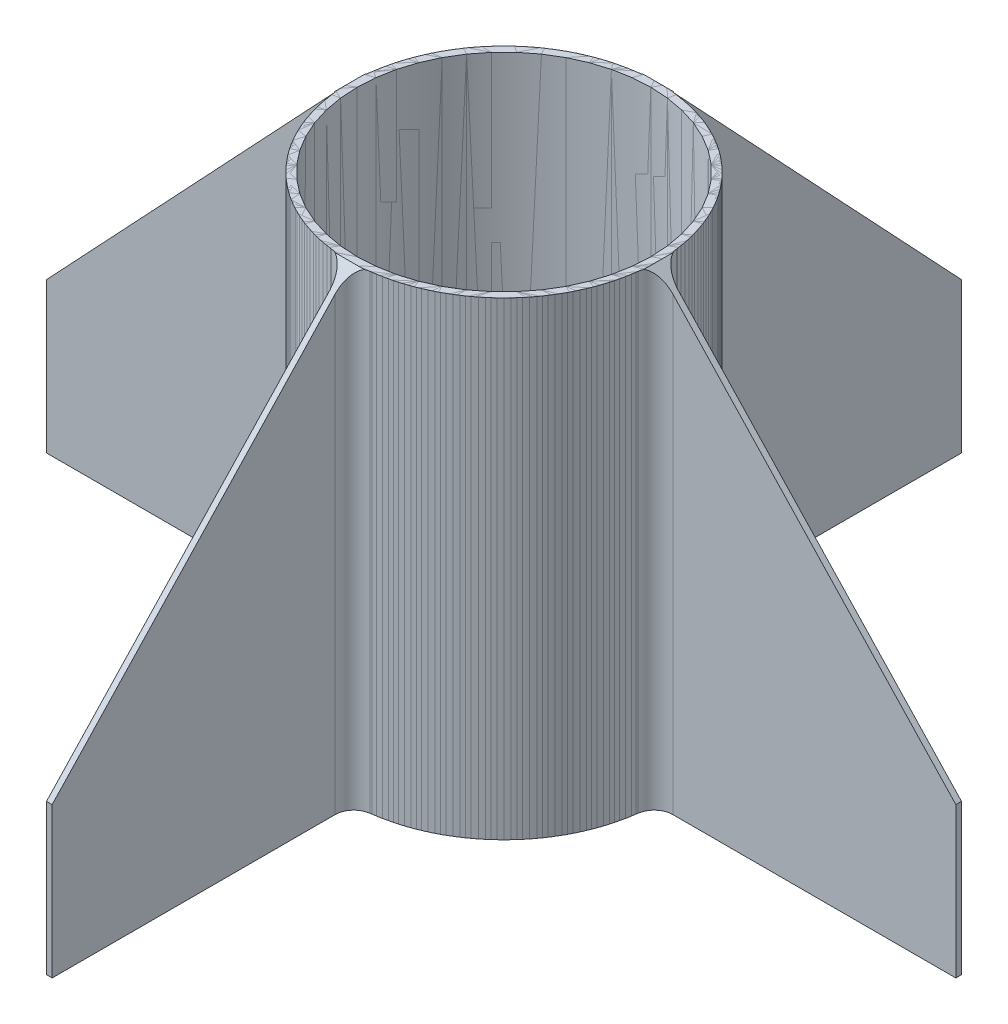
from build123d import *

# Parameters (mm, degrees)
SKETCH1_R                = 82.2
SKETCH1_R_2              = 78.2
BOSS_EXTRUDE1_DEPTH      = 250
BOSS_EXTRUDE2_DEPTH      = 1.5
BOSS_EXTRUDE2_DEPTH_BACK = 1.5
BOSS_EXTRUDE3_DEPTH      = 1.5
BOSS_EXTRUDE3_DEPTH_BACK = 1.5
SKETCH4_W                = 2
SKETCH4_H                = 250
FILLET1_R                = 10
CIRPATTERN1_COUNT        = 4


with BuildPart() as part:
    # Sketch1 → Boss-Extrude1 (new body)
    with BuildSketch(Plane(origin=(0, 0, 0), x_dir=(1, 0, 0), z_dir=(0, 1, 0))):
        with Locations(Location((0, 0, 0), (0, 0, 270))):
            Circle(SKETCH1_R)
        with Locations(Location((0, 0, 0), (0, 0, 270))):
            Circle(SKETCH1_R_2, mode=Mode.SUBTRACT)
    extrude(amount=BOSS_EXTRUDE1_DEPTH)



with BuildPart() as body_2:
    # Sketch2 → Boss-Extrude2 (new, two sides: drawn at the far end of the back side and taken through both)
    with BuildSketch(Plane.XY.offset(-BOSS_EXTRUDE2_DEPTH_BACK)):
        Polygon((82.2, 0), (82.2, 250), (242.2, 80), (242.2, 0), align=None)
    extrude(amount=BOSS_EXTRUDE2_DEPTH + BOSS_EXTRUDE2_DEPTH_BACK)


with BuildPart() as part_1:
    add(part.part)

    add(body_2.part)  # Boss-Extrude3 merges body 2
    # Sketch4 → Boss-Extrude3 (add, two sides: drawn at the far end of the back side and taken through both)
    with BuildSketch(Plane.XY.offset(-BOSS_EXTRUDE3_DEPTH_BACK)):
        with Locations((81.2, 125)):
            Rectangle(SKETCH4_W, SKETCH4_H)
    extrude(amount=BOSS_EXTRUDE3_DEPTH + BOSS_EXTRUDE3_DEPTH_BACK)

    # Fillet1
    # the kernel refuses this fillet: 10 mm, written as the material it adds along each edge
    with BuildSketch(Plane(origin=(82.186312729, 250, -1.5), x_dir=(1, 0, 0), z_dir=(0, -1, 0))) as fillet1_piece_1_section:
        with BuildLine():
            CenterArc((9.293685085, -10), FILLET1_R, 90, 82.834902495)
            ThreePointArc((-0.628223572, -8.752711497), (-0.19722945, -4.384744947), (0, 0))
            Line((0, 0), (9.293685085, 0))
        make_face()
    fillet1_piece_1 = extrude(amount=250, mode=Mode.PRIVATE)
    fillet1_piece_1 = split(fillet1_piece_1, bisect_by=Plane(origin=(146.068392849, 182.139832598, -3.473148008), z_dir=(-0.7281999926928029, -0.685364699004991, 0)), keep=Keep.TOP, mode=Mode.PRIVATE)
    add(fillet1_piece_1)
    with BuildSketch(Plane(origin=(82.186312729, 250, 1.5), x_dir=(-0.07159057113580586, 0, 0.9974341031488995), z_dir=(0, -1, 0))) as fillet1_piece_2_section:
        with BuildLine():
            CenterArc((9.309000808, -9.985744159), FILLET1_R, 93.059748024, 82.834902495)
            Line((-0.665340223, -9.269838447), (0, 0))
            ThreePointArc((0, 0), (4.387613913, -0.117183015), (8.775227826, 0))
        make_face()
    fillet1_piece_2 = extrude(amount=250, mode=Mode.PRIVATE)
    fillet1_piece_2 = split(fillet1_piece_2, bisect_by=Plane(origin=(146.06839285, 182.139832597, 3.473148008), z_dir=(-0.7281999926928029, -0.685364699004991, 0)), keep=Keep.TOP, mode=Mode.PRIVATE)
    add(fillet1_piece_2)


with BuildPart() as cirpattern1_1:
    # CirPattern1: pattern copy
    add(part_1.part.rotate(Axis((0, 0, 0), (0, 1, 0)), 1 * 360 / CIRPATTERN1_COUNT))


with BuildPart() as cirpattern1_2:
    # CirPattern1: pattern copy
    add(part_1.part.rotate(Axis((0, 0, 0), (0, 1, 0)), 2 * 360 / CIRPATTERN1_COUNT))


with BuildPart() as cirpattern1_3:
    # CirPattern1: pattern copy
    add(part_1.part.rotate(Axis((0, 0, 0), (0, 1, 0)), 3 * 360 / CIRPATTERN1_COUNT))


solid = Compound([part_1.part, cirpattern1_1.part, cirpattern1_2.part, cirpattern1_3.part])
